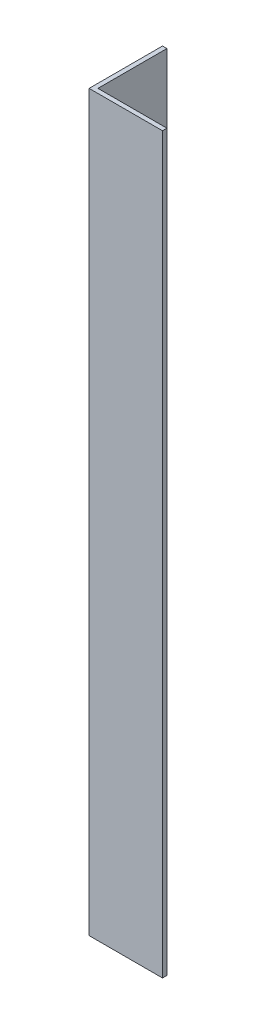
from build123d import *

# Parameters (mm, degrees)
EXTRUDE_1_DEPTH = 500


with BuildPart() as part:
    # Эскиз1 → Вытянуть-Тонкостенный1 (new body)
    with BuildSketch(Plane(origin=(0, 0, 0), x_dir=(1, 0, 0), z_dir=(0, 1, 0))):
        Polygon((0, 50), (0, 0), (50, 0), (50, 3), (3, 3), (3, 50), align=None)
    extrude(amount=EXTRUDE_1_DEPTH)


solid = part.part
